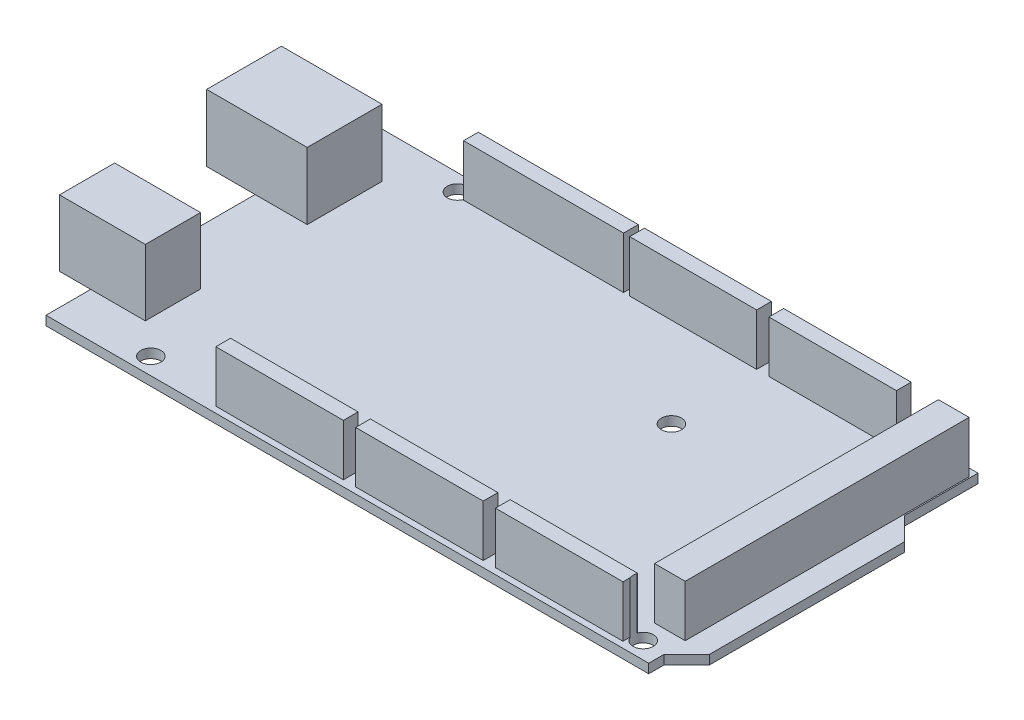
from build123d import *

# Parameters (mm, degrees)
SKETCH_2_W               = 102
SKETCH_2_H               = 53.7
EXTRUDE_1_DEPTH          = 1.5
SKETCH_3_W               = 16.4
SKETCH_3_H               = 12.2
EXTRUDE_2_DEPTH          = 10.9
SKETCH_5_W               = 14
SKETCH_5_H               = 9
EXTRUDE_3_DEPTH          = 10.8
SKETCH_6_W               = 20.8
SKETCH_6_H               = 2.4
SKETCH_6_W_2             = 26.1
SKETCH_6_W_3             = 20.7
SKETCH_6_W_4             = 5
SKETCH_6_H_2             = 46.3
EXTRUDE_6_DEPTH          = 8.4
SKETCH_9_W               = 3.7
SKETCH_9_H               = 12
SKETCH_9_H_2             = 2.5
CUT_EXTRUDE_1_DEPTH      = 69.545367627
CHAMFER_1_SIZE           = 3.7
CUT_EXTRUDE_2_DEPTH      = 69.545367627
CUT_EXTRUDE_2_DEPTH_BACK = 69.545367627
SKETCH_7_R               = 1.65


with BuildPart() as part:
    # Эскиз2 → Бобышка-Вытянуть1 (new body)
    with BuildSketch(Plane(origin=(0, 0, 0), x_dir=(1, 0, 0), z_dir=(0, 1, 0))):
        with Locations((-2.938983051, 0.638135593)):
            Rectangle(SKETCH_2_W, SKETCH_2_H)
    extrude(amount=EXTRUDE_1_DEPTH)

    # Эскиз3 → Бобышка-Вытянуть2 (add)
    with BuildSketch(Plane(origin=(0, 1.5, 0), x_dir=(1, 0, 0), z_dir=(0, 1, 0))):
        with Locations((-53.638983051, 13.988135593)):
            Rectangle(SKETCH_3_W, SKETCH_3_H)
    extrude(amount=EXTRUDE_2_DEPTH)

    # Эскиз5 → Бобышка-Вытянуть3 (add)
    with BuildSketch(Plane(origin=(0, 1.5, 0), x_dir=(1, 0, 0), z_dir=(0, 1, 0))):
        with Locations((-52.038983051, -14.411864407)):
            Rectangle(SKETCH_5_W, SKETCH_5_H)
    extrude(amount=EXTRUDE_3_DEPTH)

    # Эскиз6 → Бобышка-Вытянуть6 (add)
    with BuildSketch(Plane(origin=(0, 1.5, 0), x_dir=(1, 0, 0), z_dir=(0, 1, 0))):
        with Locations((-16.838983051, -24.011864407)):
            Rectangle(SKETCH_6_W, SKETCH_6_H)
        with Locations((5.961016949, -24.011864407)):
            Rectangle(SKETCH_6_W, SKETCH_6_H)
        with Locations((28.761016949, -24.011864407)):
            Rectangle(SKETCH_6_W, SKETCH_6_H)
        with Locations((-23.088983051, 25.288135593)):
            Rectangle(SKETCH_6_W_2, SKETCH_6_H)
        with Locations((1.311016949, 25.288135593)):
            Rectangle(SKETCH_6_W_3, SKETCH_6_H)
        with Locations((24.061016949, 25.288135593)):
            Rectangle(SKETCH_6_W, SKETCH_6_H)
        with Locations((41.661016949, 3.088135593)):
            Rectangle(SKETCH_6_W_4, SKETCH_6_H_2)
    extrude(amount=EXTRUDE_6_DEPTH)

    # Эскиз9 → Вырез-Вытянуть1 (cut, through all)
    with BuildSketch(Plane(origin=(0, 1.5, 0), x_dir=(1, 0, 0), z_dir=(0, 1, 0))):
        with Locations((46.211016949, 21.488135593)):
            Rectangle(SKETCH_9_W, SKETCH_9_H)
        with Locations((46.211016949, -24.961864407)):
            Rectangle(SKETCH_9_W, SKETCH_9_H_2)
    extrude(amount=-CUT_EXTRUDE_1_DEPTH, mode=Mode.SUBTRACT)

    # Фаска1
    chamfer_1_edges = [part.edges().sort_by_distance(p)[0] for p in [
        (48.061016949, 0.75, 23.711864407),
        (48.061016949, 0.75, -15.488135593),
    ]]
    chamfer(chamfer_1_edges, length=CHAMFER_1_SIZE - 0.0001)  # a hair under: the kernel refuses the full size

    # Эскиз7 → Вырез-Вытянуть2 (cut, two sides: drawn at the far end of the back side and taken through both)
    with BuildSketch(Plane(origin=(0, 1.5, 0), x_dir=(1, 0, 0), z_dir=(0, 1, 0)).offset(-CUT_EXTRUDE_2_DEPTH_BACK)):
        with Locations(Location((-37.788983051, 24.738135593, 0), (0, 0, 270))):
            Circle(SKETCH_7_R)
        with Locations(Location((-39.588983051, -23.461864407, 0), (0, 0, 270))):
            Circle(SKETCH_7_R)
        with Locations(Location((12.411016949, 9.438135593, 0), (0, 0, 270))):
            Circle(SKETCH_7_R)
        with Locations(Location((12.411016949, -18.701864407, 0), (0, 0, 270))):
            Circle(SKETCH_7_R)
        with Locations(Location((36.551016949, 24.738135593, 0), (0, 0, 270))):
            Circle(SKETCH_7_R)
        with Locations(Location((40.711016949, -23.461864407, 0), (0, 0, 270))):
            Circle(SKETCH_7_R)
    extrude(amount=CUT_EXTRUDE_2_DEPTH + CUT_EXTRUDE_2_DEPTH_BACK, mode=Mode.SUBTRACT)


solid = part.part
